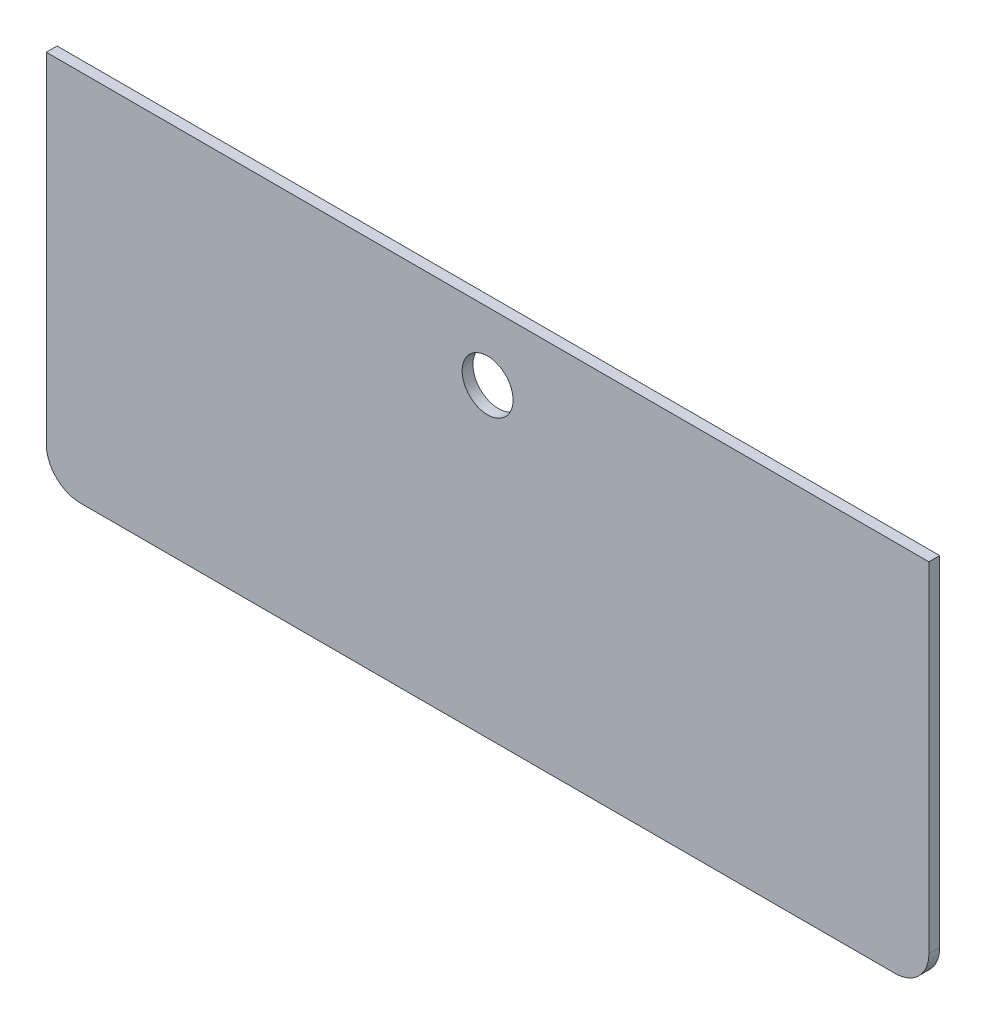
from build123d import *

# Parameters (mm, degrees)
SKETCH1_W           = 260
SKETCH1_H           = 110
SKETCH1_R           = 7.5
BOSS_EXTRUDE1_DEPTH = 3.175
FILLET1_R           = 10


with BuildPart() as part:
    # Sketch1 → Boss-Extrude1 (new body)
    with BuildSketch(Plane.XY):
        with Locations((-26.765375854, -27.813211845)):
            Rectangle(SKETCH1_W, SKETCH1_H)
        with Locations((-26.765375854, 7.186788155)):
            Circle(SKETCH1_R, mode=Mode.SUBTRACT)
    extrude(amount=BOSS_EXTRUDE1_DEPTH)

    # Fillet1
    fillet1_edges = [part.edges().sort_by_distance(p)[0] for p in [
        (-156.765375854, -82.813211845, 1.5875),
        (103.234624146, -82.813211845, 1.5875),
    ]]
    fillet(fillet1_edges, radius=FILLET1_R)


solid = part.part
